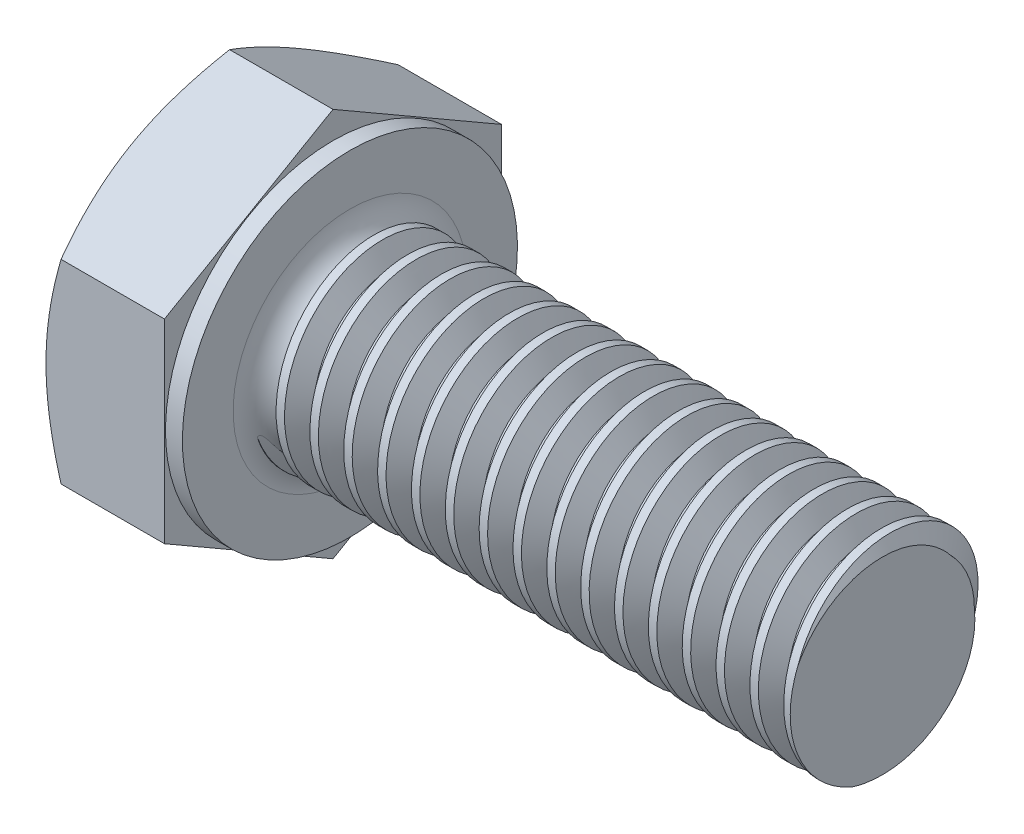
from build123d import *

# Parameters (mm, degrees)
SKETCH2_OUTSIDE_W  = 18.656
SKETCH2_OUTSIDE_H  = 18.656
CUT_EXTRUDE1_DEPTH = 22.589928207
THREAD1_PITCH      = 1


with BuildPart() as part:
    # Sketch1 → Revolve1 (revolve)
    with BuildSketch(Plane.XY):
        with BuildLine():
            Line((-20, 0), (0, 0))
            Line((0, 0), (0, 2.45))
            Line((0, 2.45), (-15, 2.45))
            ThreePointArc((-15, 2.45), (-15.707106781, 2.742893219), (-16, 3.45))
            Line((-16, 3.45), (-16, 4.95))
            Line((-16, 4.95), (-16.5, 4.95))
            Line((-16.5, 4.95), (-16.5, 5.75))
            Line((-16.5, 5.75), (-19.555235952, 5.75))
            Line((-19.555235952, 5.75), (-20, 4.979646072))
            Line((-20, 4.979646072), (-20, 0))
        make_face()
    revolve(axis=Axis((0, 0, 0), (-1, 0, 0)))

    # Sketch2 outside → Cut-Extrude1 (cut, through all)
    with BuildSketch(Plane.ZY.offset(20)):
        Rectangle(SKETCH2_OUTSIDE_W, SKETCH2_OUTSIDE_H)
        Polygon((0, 5.75), (-4.979646072, 2.875), (-4.979646072, -2.875), (0, -5.75), (4.979646072, -2.875), (4.979646072, 2.875), align=None, mode=Mode.SUBTRACT)
    extrude(amount=-CUT_EXTRUDE1_DEPTH, mode=Mode.SUBTRACT)

    # Thread1: the profile of Thread Profile3 profile screwed along a right-hand helix of 17 turns, 8 arcs to a turn; built about Z, then put on its axis
    thread1_z = Axis((0, 0, 0), (0, 0, 1))
    thread1_corners = [(2.4497, 0, -0.000173205), (2.4497, 0, 0.875173202), (2.991265875, 0, 0.562499999), (2.991265875, 0, 0.312499999)]
    with BuildLine(mode=Mode.PRIVATE) as thread1_profile:
        Line(thread1_corners[0], thread1_corners[1])
        Line(thread1_corners[1], thread1_corners[2])
        Line(thread1_corners[2], thread1_corners[3])
        Line(thread1_corners[3], thread1_corners[0])
    thread1_cap = Face(thread1_profile.wire())
    thread1_turn_angles = [0, 22.5, 45, 67.5, 90, 112.5, 135, 157.5, 180, 202.5, 225, 247.5, 270, 292.5, 315, 337.5, 360]
    thread1_turn_weights = [1, 0.9238795325112867, 1, 0.9238795325112867, 1, 0.9238795325112867, 1, 0.9238795325112867, 1, 0.9238795325112867, 1, 0.9238795325112867, 1, 0.9238795325112867, 1, 0.9238795325112867, 1]
    thread1_turn_rails = [Edge.make_bspline([Vector(p[0], p[1], 0).rotate(thread1_z, thread1_turn_angles[k]) / thread1_turn_weights[k] + Vector(0, 0, p[2] + THREAD1_PITCH * thread1_turn_angles[k] / 360) for k in range(17)], [0, 0, 0, 1, 1, 2, 2, 3, 3, 4, 4, 5, 5, 6, 6, 7, 7, 8, 8, 8], 2, thread1_turn_weights) for p in thread1_corners]
    thread1_turn_sides = [Face.make_surface_from_curves(thread1_turn_rails[p[0]], thread1_turn_rails[p[1]]) for p in [(0, 1), (1, 2), (2, 3), (3, 0)]]
    thread1 = Plane(origin=(-17, 0, 0), x_dir=(0, 0, -1), z_dir=(1, 0, 0)) * Solid(Shell([*[p.moved(Location((0, 0, THREAD1_PITCH * i))) for i in range(17) for p in thread1_turn_sides], thread1_cap, thread1_cap.rotate(thread1_z, 6120).moved(Location((0, 0, THREAD1_PITCH * 6120 / 360)))]))
    add(thread1)

    # SurfaceCut2
    split(bisect_by=Plane(origin=(0, 0, 0), x_dir=(0, 0, -1), z_dir=(1, 0, 0)), keep=Keep.BOTTOM)


solid = part.part
